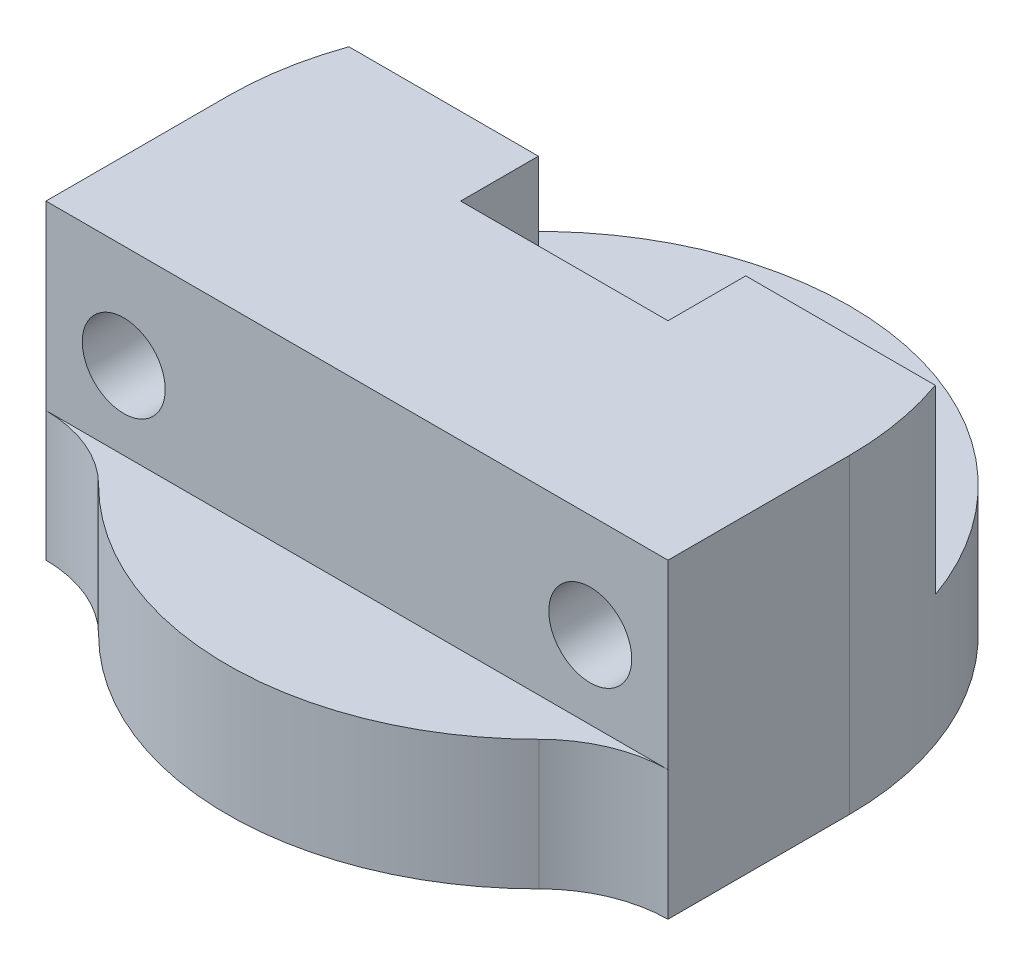
from build123d import *

# Parameters (mm, degrees)
EXTRUDE_1_DEPTH     = 5
EXTRUDE_2_DEPTH     = 7
SKETCH_3_R          = 1.5
CUT_EXTRUDE_1_DEPTH = 10
SKETCH_4_R          = 1.6
CUT_EXTRUDE_2_DEPTH = 3.5
SKETCH_5_W          = 8
SKETCH_5_H          = 4
CUT_EXTRUDE_4_DEPTH = 21.784609691
FILLET_1_R          = 5


with BuildPart() as part:
    # 草图1 → 凸台-拉伸1 (new body)
    with BuildSketch(Plane(origin=(0, 0, 0), x_dir=(1, 0, 0), z_dir=(0, 1, 0))):
        with BuildLine():
            ThreePointArc((12, 0), (0, 12), (-12, 0))
            Line((-12, 0), (12, 0))
        make_face()
        with BuildLine():
            ThreePointArc((-12, 0), (-11.422817781, -3.676851089), (-9.746794345, -7))
            Line((-9.746794345, -7), (9.746794345, -7))
            ThreePointArc((9.746794345, -7), (11.422817781, -3.676851089), (12, 0))
            Line((12, 0), (-12, 0))
        make_face()
        with BuildLine():
            Line((-12, 0), (-12, -7))
            Line((-12, -7), (-9.746794345, -7))
            ThreePointArc((-9.746794345, -7), (-11.422817781, -3.676851089), (-12, 0))
        make_face()
        with BuildLine():
            Line((9.746794345, -7), (-9.746794345, -7))
            ThreePointArc((-9.746794345, -7), (0, -12), (9.746794345, -7))
        make_face()
        with BuildLine():
            ThreePointArc((12, 0), (11.422817781, -3.676851089), (9.746794345, -7))
            Line((9.746794345, -7), (12, -7))
            Line((12, -7), (12, 0))
        make_face()
    extrude(amount=EXTRUDE_1_DEPTH)

    # 草图2 → 凸台-拉伸2 (add)
    with BuildSketch(Plane(origin=(0, 5, 0), x_dir=(1, 0, 0), z_dir=(0, 1, 0))):
        with BuildLine():
            Line((-12, 0), (-12, -7))
            Line((-12, -7), (-9.746794345, -7))
            Line((-9.746794345, -7), (9.746794345, -7))
            Line((9.746794345, -7), (12, -7))
            Line((12, -7), (12, 0))
            ThreePointArc((12, 0), (11.827182716, 2.029223745), (11.313708499, 4))
            Line((11.313708499, 4), (-11.313708499, 4))
            ThreePointArc((-11.313708499, 4), (-11.827182716, 2.029223745), (-12, 0))
        make_face()
    extrude(amount=EXTRUDE_2_DEPTH)

    # 草图3 → 切除-拉伸1 (cut)
    with BuildSketch(Plane.XZ):
        with Locations(Location((9, 0, 0), (0, 0, 270))):
            Circle(SKETCH_3_R)
        with Locations(Location((-9, 0, 0), (0, 0, 90))):
            Circle(SKETCH_3_R)
    extrude(amount=-CUT_EXTRUDE_1_DEPTH, mode=Mode.SUBTRACT)

    # 草图4 → 切除-拉伸2 (cut)
    with BuildSketch(Plane.XY.offset(7)):
        with Locations((9, 8)):
            Circle(SKETCH_4_R)
        with Locations(Location((-9, 8, 0), (0, 0, 180))):
            Circle(SKETCH_4_R)
    extrude(amount=-CUT_EXTRUDE_2_DEPTH, mode=Mode.SUBTRACT)

    # 草图5 → 切除-拉伸4 (cut, through all)
    with BuildSketch(Plane(origin=(0, 12, 0), x_dir=(1, 0, 0), z_dir=(0, 1, 0))):
        with Locations((0, 3)):
            Rectangle(SKETCH_5_W, SKETCH_5_H)
    extrude(amount=-CUT_EXTRUDE_4_DEPTH, mode=Mode.SUBTRACT)

    # 圆角1
    # the kernel refuses this fillet: 5 mm, written as the material it adds along each edge
    with BuildSketch(Plane(origin=(-9.746794345, 0, 7), x_dir=(0.6466979741325999, 0, 0.7627461768195178), z_dir=(0, 1, 0))) as fillet_1_piece_1_section:
        with BuildLine():
            CenterArc((2.329688222, -4.983839976), FILLET_1_R, 94.607768722, 45.099127844)
            Line((-1.484042662, -1.750350105), (0, 0))
            ThreePointArc((0, 0), (0.964008919, -0.038784058), (1.928017839, 0))
        make_face()
    fillet_1_piece_1 = extrude(amount=5, mode=Mode.PRIVATE)
    fillet_1_piece_1 = split(fillet_1_piece_1, bisect_by=Plane(origin=(-12, 2.5, 7.309223298), z_dir=(1, 0, 0)), keep=Keep.TOP, mode=Mode.PRIVATE)
    add(fillet_1_piece_1)
    with BuildSketch(Plane(origin=(9.746794345, 0, 7), x_dir=(-0.6466979741326015, 0, 0.7627461768195165), z_dir=(0, 1, 0))) as fillet_1_piece_2_section:
        with BuildLine():
            CenterArc((2.329688222, 4.983839976), FILLET_1_R, 220.293103434, 45.099127844)
            Line((-1.484042662, 1.750350105), (0, 0))
            ThreePointArc((0, 0), (0.964008919, 0.038784058), (1.928017839, 0))
        make_face()
    fillet_1_piece_2 = extrude(amount=5, mode=Mode.PRIVATE)
    fillet_1_piece_2 = split(fillet_1_piece_2, bisect_by=Plane(origin=(12, 2.5, 7.309223298), z_dir=(-1, 0, 0)), keep=Keep.TOP, mode=Mode.PRIVATE)
    add(fillet_1_piece_2)


solid = part.part
